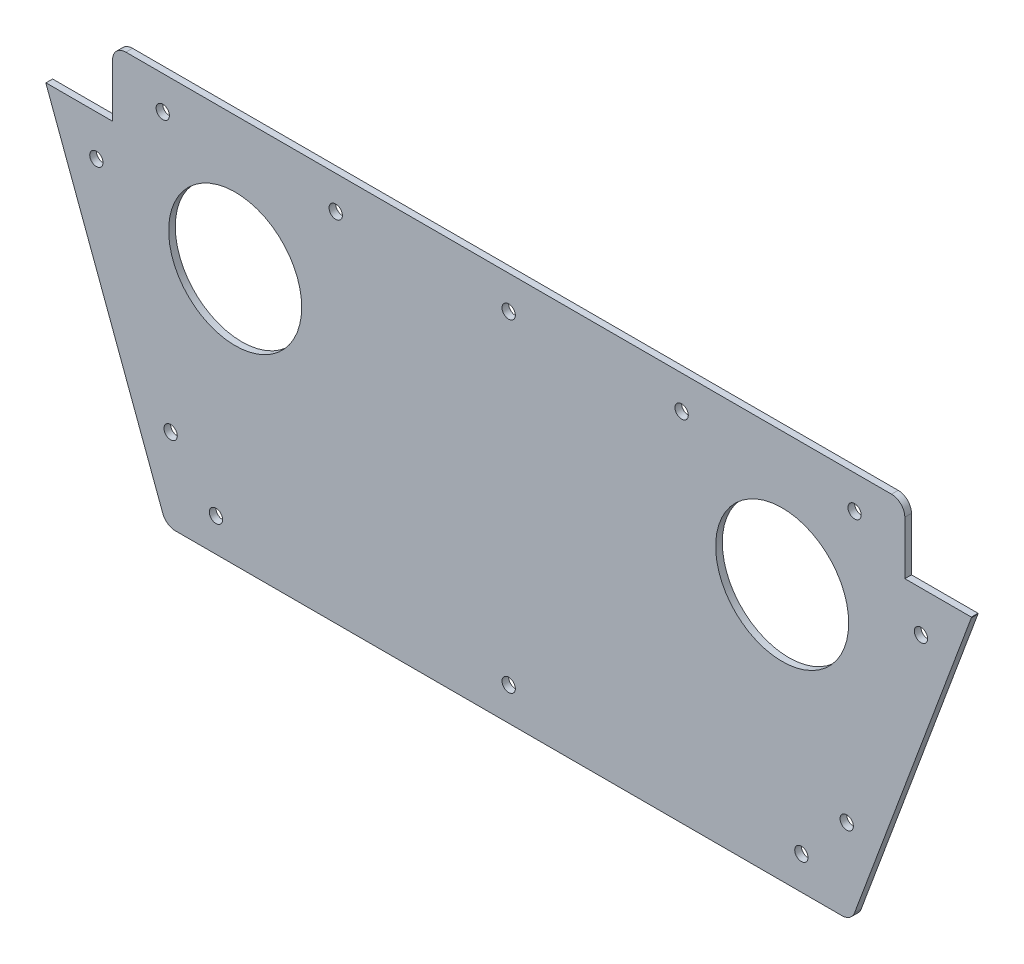
from build123d import *

# Parameters (mm, degrees)
SM_BASE_FLANGE_1_DEPTH = 1
SKETCH_3_R             = 1
SKETCH_3_R_2           = 10
SKETCH_3_W             = 10
SKETCH_3_H             = 10
CUT_EXTRUDE_1_DEPTH    = 2
FILLET_1_R             = 2


# Sheet-metal steps are written as plain solids
with BuildPart() as part:
    # Sketch 1 → 基材-凸緣1 (new body)
    with BuildSketch(Plane.XY):
        Polygon((-69.55, 38.6), (69.55, 38.6), (69.55, 28.5), (51.5, -20), (-51.5, -20), (-69.55, 28.5), align=None)
    extrude(amount=-SM_BASE_FLANGE_1_DEPTH)

    # 草圖3 → 除料-伸長1 (cut)
    with BuildSketch(Plane.XY):
        with Locations((0, -15)):
            Circle(SKETCH_3_R)
        with Locations((44, -15)):
            Circle(SKETCH_3_R)
        with Locations((-44, -15)):
            Circle(SKETCH_3_R)
        with Locations((-50.81612653, -7.502401461)):
            Circle(SKETCH_3_R)
        with Locations((-61.977500026, 22.487992696)):
            Circle(SKETCH_3_R)
        with Locations((0, 33.6)):
            Circle(SKETCH_3_R)
        with Locations((-26, 33.6)):
            Circle(SKETCH_3_R)
        with Locations((-52, 33.6)):
            Circle(SKETCH_3_R)
        with Locations((26, 33.6)):
            Circle(SKETCH_3_R)
        with Locations((52, 33.6)):
            Circle(SKETCH_3_R)
        with Locations((61.977500026, 22.487992696)):
            Circle(SKETCH_3_R)
        with Locations((50.81612653, -7.502401461)):
            Circle(SKETCH_3_R)
        with Locations((-41.112999651, 18.6)):
            Circle(SKETCH_3_R_2)
        with Locations((41.112999651, 18.6)):
            Circle(SKETCH_3_R_2)
        with Locations((-64.55, 33.6)):
            Rectangle(SKETCH_3_W, SKETCH_3_H)
        with Locations((64.55, 33.6)):
            Rectangle(SKETCH_3_W, SKETCH_3_H)
    extrude(amount=-CUT_EXTRUDE_1_DEPTH, mode=Mode.SUBTRACT)

    # 圓角1
    fillet_1_edges = [part.edges().sort_by_distance(p)[0] for p in [
        (51.5, -20, -0.5),
        (-51.5, -20, -0.5),
        (59.55, 38.6, -0.5),
        (-59.55, 38.6, -0.5),
    ]]
    fillet(fillet_1_edges, radius=FILLET_1_R)


solid = part.part
